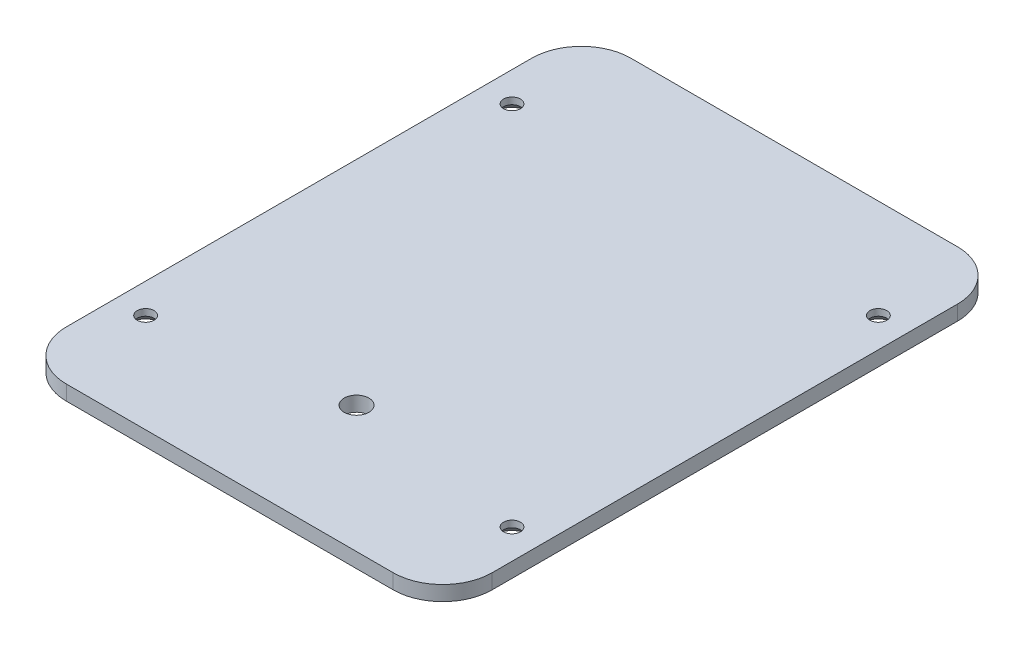
from build123d import *

# Parameters (mm, degrees)
BOSS_EXTRUDE1_DEPTH                                  = 3
SKETCH3_R                                            = 2.5
CUT_EXTRUDE1_DEPTH                                   = 3
CSK_FOR_M3_HEX_SOCKET_COUNTERSUNK_CAP_SC_D           = 3.4
CSK_FOR_M3_HEX_SOCKET_COUNTERSUNK_CAP_SC_DEPTH       = 20
CSK_FOR_M3_HEX_SOCKET_COUNTERSUNK_CAP_SC_CSINK_D     = 6.72
CSK_FOR_M3_HEX_SOCKET_COUNTERSUNK_CAP_SC_CSINK_ANGLE = 90
CSK_FOR_M3_HEX_SOCKET_COUNTERSUNK_CAP_SC_TIP         = 1.021463052


with BuildPart() as part:
    # Sketch1 → Boss-Extrude1 (new body)
    with BuildSketch(Plane(origin=(0, 0, 0), x_dir=(1, 0, 0), z_dir=(0, 1, 0))):
        with BuildLine():
            Line((33, -57), (-33, -57))
            ThreePointArc((-33, -57), (-40.071067812, -54.071067812), (-43, -47))
            Line((-43, -47), (-43, 47))
            ThreePointArc((-43, 47), (-40.071067812, 54.071067812), (-33, 57))
            Line((-33, 57), (33, 57))
            ThreePointArc((33, 57), (40.071067812, 54.071067812), (43, 47))
            Line((43, 47), (43, -47))
            ThreePointArc((43, -47), (40.071067812, -54.071067812), (33, -57))
        make_face()
    extrude(amount=BOSS_EXTRUDE1_DEPTH)

    # Sketch3 → Cut-Extrude1 (cut)
    with BuildSketch(Plane.XZ):
        with Locations((0, 31.4)):
            Circle(SKETCH3_R)
    extrude(amount=-CUT_EXTRUDE1_DEPTH, mode=Mode.SUBTRACT)

    # CSK for M3 Hex Socket Countersunk Cap Screw1
    with Locations(Plane(origin=(0, 0, 0), x_dir=(-1, 0, 0), z_dir=(0, -1, 0))):
        with Locations((37, 37), (37, -37), (-37, 37), (-37, -37)):
            CounterSinkHole(CSK_FOR_M3_HEX_SOCKET_COUNTERSUNK_CAP_SC_D / 2, CSK_FOR_M3_HEX_SOCKET_COUNTERSUNK_CAP_SC_CSINK_D / 2, depth=CSK_FOR_M3_HEX_SOCKET_COUNTERSUNK_CAP_SC_DEPTH, counter_sink_angle=CSK_FOR_M3_HEX_SOCKET_COUNTERSUNK_CAP_SC_CSINK_ANGLE)
            with Locations((0, 0, -(CSK_FOR_M3_HEX_SOCKET_COUNTERSUNK_CAP_SC_DEPTH + CSK_FOR_M3_HEX_SOCKET_COUNTERSUNK_CAP_SC_TIP / 2))):  # 118° drill point
                Cone(0, CSK_FOR_M3_HEX_SOCKET_COUNTERSUNK_CAP_SC_D / 2, CSK_FOR_M3_HEX_SOCKET_COUNTERSUNK_CAP_SC_TIP, mode=Mode.SUBTRACT)


solid = part.part
